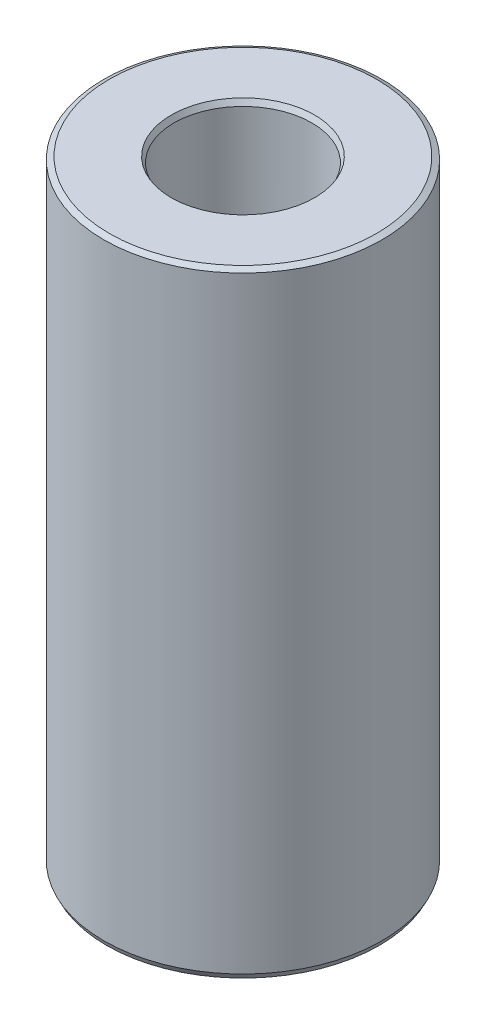
from build123d import *
from OCP.BRepFilletAPI import BRepFilletAPI_MakeChamfer

# Parameters (mm, degrees)
SKETCH1_R           = 42.5
BOSS_EXTRUDE1_DEPTH = 188.023063463
SKETCH2_R           = 21.065258297
CUT_EXTRUDE1_DEPTH  = 198.395978667
CHAMFER1_SIZE       = 0.843604419
CHAMFER1_SIZE2      = 1.669420422


with BuildPart() as part:
    # Sketch1 → Boss-Extrude1 (new body)
    with BuildSketch(Plane(origin=(0, 0, 0), x_dir=(1, 0, 0), z_dir=(0, 1, 0))):
        Circle(SKETCH1_R)
    extrude(amount=BOSS_EXTRUDE1_DEPTH)

    # Sketch2 → Cut-Extrude1 (cut, through all)
    with BuildSketch(Plane(origin=(0, 0, 0), x_dir=(1, 0, 0), z_dir=(0, 1, 0))):
        Circle(SKETCH2_R)
    extrude(amount=CUT_EXTRUDE1_DEPTH, mode=Mode.SUBTRACT)

    # Chamfer1: one chamfer whose edges measure the first distance from different faces: ONE call of the kernel's chamfer builder (chamfer() names one face for all edges)
    chamfer1_edges_1 = [part.edges().sort_by_distance(p)[0] for p in [
        (-21.065258297, 188.023063463, 0),
    ]]
    chamfer1_side_1 = [part.faces().sort_by_distance(p)[0] for p in [
        (-41.297918472, 188.023063463, 0),
    ]]
    chamfer1_edges_2 = [part.edges().sort_by_distance(p)[0] for p in [
        (-21.065258297, 0, 0),
    ]]
    chamfer1_side_2 = [part.faces().sort_by_distance(p)[0] for p in [
        (-21.065258297, 94.011531731, 0),
    ]]
    chamfer1_edges_3 = [part.edges().sort_by_distance(p)[0] for p in [
        (-42.5, 0, 0),
    ]]
    chamfer1_side_3 = [part.faces().sort_by_distance(p)[0] for p in [
        (-41.297918472, 0, 0),
    ]]
    chamfer1_edges_4 = [part.edges().sort_by_distance(p)[0] for p in [
        (-42.5, 188.023063463, 0),
    ]]
    chamfer1_side_4 = [part.faces().sort_by_distance(p)[0] for p in [
        (-42.5, 94.011531731, 0),
    ]]
    chamfer1 = BRepFilletAPI_MakeChamfer(part.part.solid().wrapped)
    for e in chamfer1_edges_1:
        chamfer1.Add(CHAMFER1_SIZE, CHAMFER1_SIZE2, e.wrapped, chamfer1_side_1[0].wrapped)  # the first distance lies on this face
    for e in chamfer1_edges_2:
        chamfer1.Add(CHAMFER1_SIZE, CHAMFER1_SIZE2, e.wrapped, chamfer1_side_2[0].wrapped)  # the first distance lies on this face
    for e in chamfer1_edges_3:
        chamfer1.Add(CHAMFER1_SIZE, CHAMFER1_SIZE2, e.wrapped, chamfer1_side_3[0].wrapped)  # the first distance lies on this face
    for e in chamfer1_edges_4:
        chamfer1.Add(CHAMFER1_SIZE, CHAMFER1_SIZE2, e.wrapped, chamfer1_side_4[0].wrapped)  # the first distance lies on this face
    add(Compound.cast(chamfer1.Shape()), mode=Mode.REPLACE)


solid = part.part
